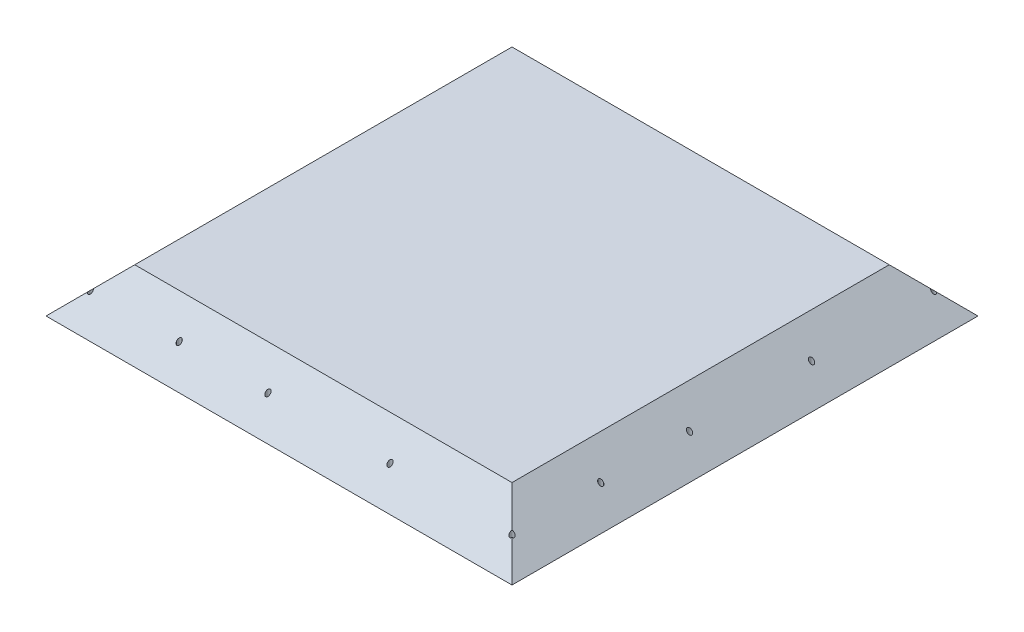
from build123d import *

# Parameters (mm, degrees)
CENTERSKETCH1_W            = 210
CENTERSKETCH1_H            = 210
CENTERBOSS_EXTRUDE1_DEPTH  = 20
TABHOLESSKETCH1_R          = 1
TABHOLESCUT_EXTRUDE1_DEPTH = 17
CHAMFER1_SIZE              = 20


with BuildPart() as part:
    # CenterSketch1 → CenterBoss-Extrude1 (new body)
    with BuildSketch(Plane(origin=(0, 0, 0), x_dir=(1, 0, 0), z_dir=(0, 1, 0))):
        with Locations((105, 105)):
            Rectangle(CENTERSKETCH1_W, CENTERSKETCH1_H)
    extrude(amount=CENTERBOSS_EXTRUDE1_DEPTH)

    # TabHolesSketch1 → TabHolesCut-Extrude1 (cut)
    with BuildSketch(Plane(origin=(0, 20, 0), x_dir=(1, 0, 0), z_dir=(0, 1, 0))):
        with Locations(Location((10, 10, 0), (0, 0, 270))):
            Circle(TABHOLESSKETCH1_R)
        with Locations(Location((200, 10, 0), (0, 0, 270))):
            Circle(TABHOLESSKETCH1_R)
        with Locations(Location((200, 200, 0), (0, 0, 270))):
            Circle(TABHOLESSKETCH1_R)
        with Locations(Location((10, 200, 0), (0, 0, 270))):
            Circle(TABHOLESSKETCH1_R)
        with Locations(Location((65, 200, 0), (0, 0, 270))):
            Circle(TABHOLESSKETCH1_R)
        with Locations(Location((120, 200, 0), (0, 0, 270))):
            Circle(TABHOLESSKETCH1_R)
        with Locations(Location((160, 200, 0), (0, 0, 270))):
            Circle(TABHOLESSKETCH1_R)
        with Locations(Location((10, 160, 0), (0, 0, 270))):
            Circle(TABHOLESSKETCH1_R)
        with Locations(Location((10, 65, 0), (0, 0, 270))):
            Circle(TABHOLESSKETCH1_R)
        with Locations(Location((10, 120, 0), (0, 0, 270))):
            Circle(TABHOLESSKETCH1_R)
        with Locations(Location((50, 10, 0), (0, 0, 270))):
            Circle(TABHOLESSKETCH1_R)
        with Locations(Location((90, 10, 0), (0, 0, 270))):
            Circle(TABHOLESSKETCH1_R)
        with Locations(Location((145, 10, 0), (0, 0, 270))):
            Circle(TABHOLESSKETCH1_R)
        with Locations(Location((200, 145, 0), (0, 0, 270))):
            Circle(TABHOLESSKETCH1_R)
        with Locations(Location((200, 90, 0), (0, 0, 270))):
            Circle(TABHOLESSKETCH1_R)
        with Locations(Location((200, 50, 0), (0, 0, 270))):
            Circle(TABHOLESSKETCH1_R)
    extrude(amount=-TABHOLESCUT_EXTRUDE1_DEPTH, mode=Mode.SUBTRACT)

    # Chamfer1
    # the kernel refuses this chamfer: 20 mm, written as the material it takes off along each edge
    with BuildSketch(Plane(origin=(-51.433659759, 20, 0), x_dir=(0, -0.9996219169112968, 0.027495876610586372), z_dir=(1, 0, 0)), Plane(origin=(210, 20, 51.433659759), x_dir=(0.027495876610586317, -0.9996219169112968, 0), z_dir=(0, 0, -1)), Plane(origin=(0, 20, -261.433659759), x_dir=(-0.027495876610586372, -0.9996219169112968, 0), z_dir=(0, 0, 1))) as chamfer1_piece_1:
        Polygon((CHAMFER1_SIZE * 0.999621916911, CHAMFER1_SIZE * 0.0274958766106), (-CHAMFER1_SIZE * 0.0274958766106, CHAMFER1_SIZE * 0.999621916911), (0, 0), align=None)
    extrude(amount=312.867319519, mode=Mode.SUBTRACT)
    with BuildSketch(Plane(origin=(261.433659759, 20, -210), x_dir=(0, 0.027495876610586317, 0.9996219169112968), z_dir=(-1, 0, 0))) as chamfer1_piece_2:
        Polygon((CHAMFER1_SIZE * 0.999621916911, -CHAMFER1_SIZE * 0.0274958766106), (-CHAMFER1_SIZE * 0.0274958766106, -CHAMFER1_SIZE * 0.999621916911), (0, 0), align=None)
    extrude(amount=312.867319519, mode=Mode.SUBTRACT)


solid = part.part
